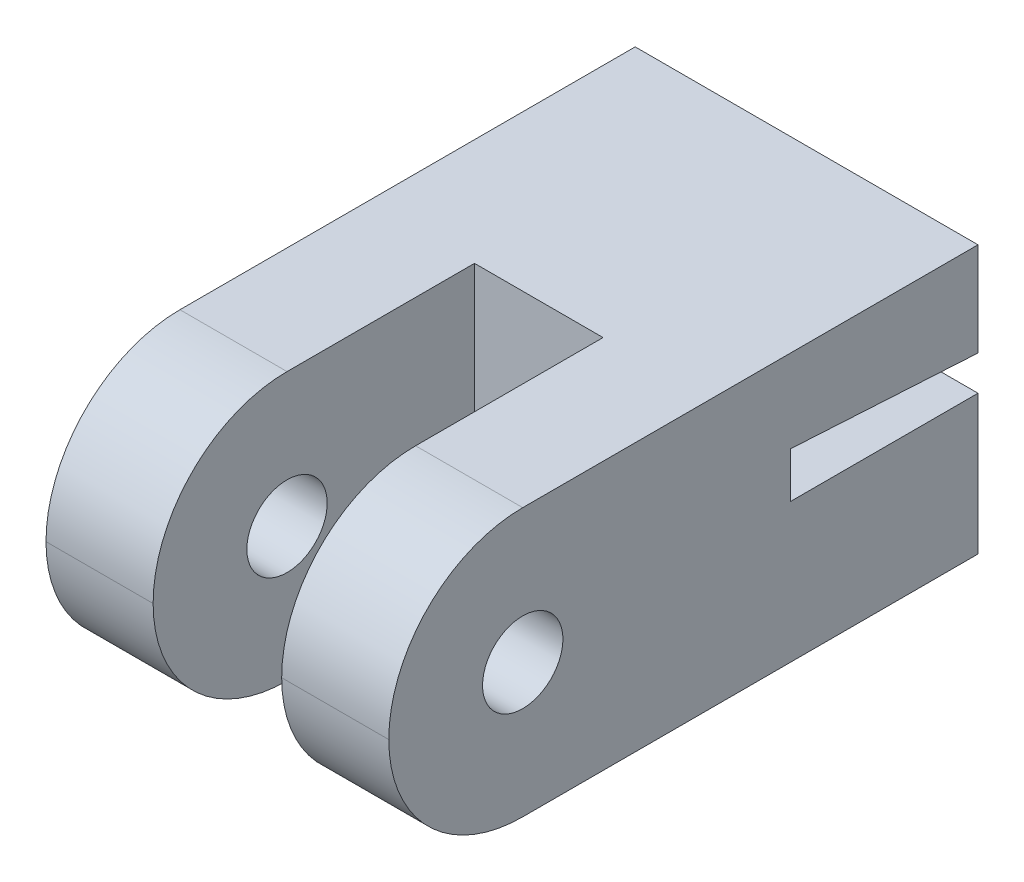
from build123d import *

# Parameters (mm, degrees)
BOSS_EXTRUDE1_DEPTH = 10
SKETCH1_3_W         = 12.8
SKETCH1_3_H         = 1.3
BOSS_EXTRUDE2_DEPTH = 7
SKETCH1_5_W         = 12.8
SKETCH1_5_H         = 1.3
CUT_EXTRUDE1_DEPTH  = 7
SKETCH4_W           = 12.8
SKETCH4_H           = 10
BOSS_EXTRUDE3_DEPTH = 1
CUT_EXTRUDE3_DEPTH  = 15
SKETCH8_W           = 12.8
SKETCH8_H           = 10
BOSS_EXTRUDE4_DEPTH = 1
SKETCH10_W          = 4
SKETCH10_H          = 10
BOSS_EXTRUDE5_DEPTH = 12
FILLET1_R           = 5
HOLE1_D             = 3
HOLE1_DEPTH         = 100


with BuildPart() as part:
    # Sketch1 → Boss-Extrude1 (new body)
    with BuildSketch(Plane.XY):
        Polygon((6.4, 4), (-6.4, 4), (-6.4, -1), (-6.4, -4), (6.4, -4), (6.4, -1), align=None)
    extrude(amount=BOSS_EXTRUDE1_DEPTH)

    # Sketch1<3> → Boss-Extrude2 (add)
    with BuildSketch(Plane.XY):
        with Locations((0, 1.85)):
            Rectangle(SKETCH1_3_W, SKETCH1_3_H)
    extrude(amount=BOSS_EXTRUDE2_DEPTH)

    # Sketch1<5> → Cut-Extrude1 (cut)
    with BuildSketch(Plane.XY):
        with Locations((0, 1.85)):
            Rectangle(SKETCH1_5_W, SKETCH1_5_H)
    extrude(amount=CUT_EXTRUDE1_DEPTH, mode=Mode.SUBTRACT)

    # Sketch4 → Boss-Extrude3 (add)
    with BuildSketch(Plane(origin=(0, 4, 0), x_dir=(1, 0, 0), z_dir=(0, 1, 0))):
        with Locations((0, -5)):
            Rectangle(SKETCH4_W, SKETCH4_H)
    extrude(amount=BOSS_EXTRUDE3_DEPTH)

    # Sketch6 → Cut-Extrude3 (cut)
    with BuildSketch(Plane(origin=(6.4, 0, 0), x_dir=(0, 0, -1), z_dir=(1, 0, 0))):
        Polygon((0, 2.5), (-7, 2.902751688), (-7, 2.5), align=None)
    extrude(amount=-CUT_EXTRUDE3_DEPTH, mode=Mode.SUBTRACT)

    # Sketch8 → Boss-Extrude4 (add)
    with BuildSketch(Plane(origin=(0, 5, 0), x_dir=(1, 0, 0), z_dir=(0, 1, 0))):
        with Locations((0, -5)):
            Rectangle(SKETCH8_W, SKETCH8_H)
    extrude(amount=BOSS_EXTRUDE4_DEPTH)

    # Sketch10 → Boss-Extrude5 (add)
    with BuildSketch(Plane.XY.offset(10)):
        with Locations((-4.4, 1)):
            Rectangle(SKETCH10_W, SKETCH10_H)
        with Locations((4.4, 1)):
            Rectangle(SKETCH10_W, SKETCH10_H)
    extrude(amount=BOSS_EXTRUDE5_DEPTH)

    # Fillet1
    fillet1_edges = [part.edges().sort_by_distance(p)[0] for p in [
        (-4.4, -4, 22),
        (-4.4, 6, 22),
        (4.4, -4, 22),
        (4.4, 6, 22),
    ]]
    fillet(fillet1_edges, radius=FILLET1_R - 0.0001)  # a hair under: the kernel refuses the full size

    # Hole1
    with Locations(Plane.ZY.offset(6.4)):
        with Locations((17, 1)):
            Hole(HOLE1_D / 2, depth=HOLE1_DEPTH)


solid = part.part
